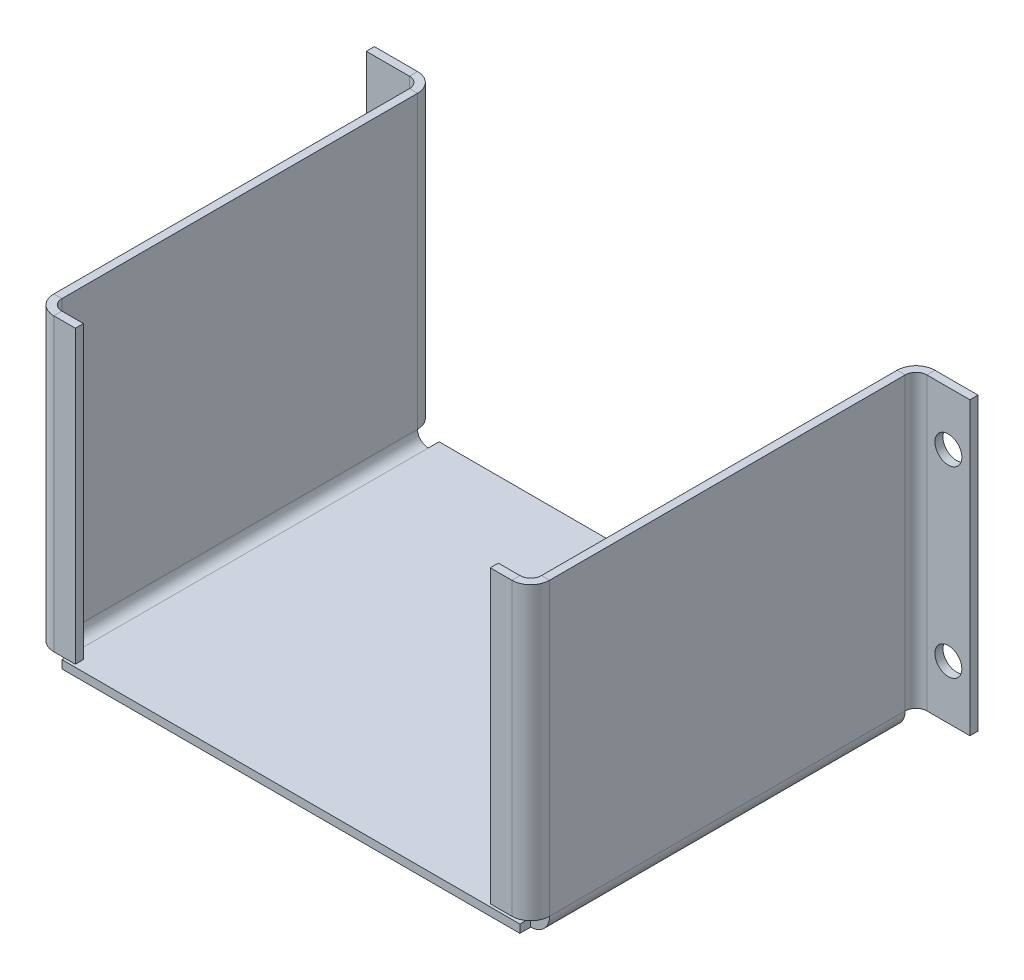
from build123d import *

# Parameters (mm, degrees)
SKETCH1_W                    = 89
SKETCH1_H                    = 70
BASE_FLANGE1_DEPTH           = 1.5
EDGE_FLANGE1_STRIP_W         = 10
EDGE_FLANGE1_STRIP_H         = 1.5
EDGE_FLANGE1_STRIP_CUT_DEPTH = 70
EDGE_FLANGE1_DEPTH           = 70
EDGE_FLANGE2_DEPTH           = 57.5
EDGE_FLANGE2_2_DEPTH         = 3.5
EDGE_FLANGE2_START           = 3.5
EDGE_FLANGE2_3_DEPTH         = 54
EDGE_FLANGE3_DEPTH           = 57.5
EDGE_FLANGE3_2_DEPTH         = 3.5
EDGE_FLANGE3_START           = 3.5
EDGE_FLANGE3_3_DEPTH         = 54
SKETCH16_R                   = 2.5
CUT_EXTRUDE1_DEPTH           = 10


# Read off the part's stored shape, not the designer's step: Edge-Flange2, Edge-Flange3
# Sheet-metal steps are written as plain solids
with BuildPart() as part:
    # Sketch1 → Base-Flange1 (new body)
    with BuildSketch(Plane(origin=(0, 0, 0), x_dir=(1, 0, 0), z_dir=(0, 1, 0))):
        Rectangle(SKETCH1_W, SKETCH1_H)
    extrude(amount=BASE_FLANGE1_DEPTH)

    # Edge-Flange1 strip (across the edge) → Edge-Flange1 strip cut (cut)
    with BuildSketch(Plane(origin=(-44.5, 1.5, -35), x_dir=(1, 0, 0), z_dir=(0, 0, 1))):
        with Locations((-3, -0.75)):
            Rectangle(EDGE_FLANGE1_STRIP_W, EDGE_FLANGE1_STRIP_H)
    edge_flange1_strip_cut = extrude(amount=EDGE_FLANGE1_STRIP_CUT_DEPTH, mode=Mode.SUBTRACT)

    # Edge-Flange1 section (across the edge) → Edge-Flange1 (add)
    with BuildSketch(Plane(origin=(-44.5, 1.5, -35), x_dir=(1, 0, 0), z_dir=(0, 0, 1))):
        with BuildLine():
            Line((-1.5, 2), (-1.5, 56))
            Line((-1.5, 56), (0, 56))
            Line((0, 56), (0, 2))
            ThreePointArc((0, 2), (0.585786438, 0.585786438), (2, 0))
            Line((2, 0), (2, -1.5))
            ThreePointArc((2, -1.5), (-0.474873734, -0.474873734), (-1.5, 2))
        make_face()
    edge_flange1 = extrude(amount=EDGE_FLANGE1_DEPTH)

    # Mirror1: Edge-Flange1 strip cut, Edge-Flange1 across plane
    add(edge_flange1_strip_cut.mirror(Plane(origin=(0, 0, 0), x_dir=(0, 0, 1), z_dir=(1, 0, 0))), mode=Mode.SUBTRACT)
    add(edge_flange1.mirror(Plane(origin=(0, 0, 0), x_dir=(0, 0, 1), z_dir=(1, 0, 0))))

    # Edge-Flange2 outline → Edge-Flange2 (cut)
    with BuildSketch(Plane(origin=(0, 0, 0), x_dir=(1, 0, 0), z_dir=(0, 1, 0))):
        with BuildLine():
            Line((45.127718677, 35), (42.5, 35))
            Line((42.5, 35), (42.5, 33))
            Line((42.5, 33), (44.5, 33))
            ThreePointArc((44.5, 33), (44.66061498, 34.048097173), (45.127718677, 35))
        make_face()
    edge_flange2 = extrude(amount=EDGE_FLANGE2_DEPTH, mode=Mode.SUBTRACT)

    # Edge-Flange2 2 outline → Edge-Flange2 2 (cut)
    with BuildSketch(Plane(origin=(0, 0, 0), x_dir=(1, 0, 0), z_dir=(0, 1, 0))):
        with BuildLine():
            ThreePointArc((45.127718677, 35), (44.66061498, 34.048097173), (44.5, 33))
            Line((44.5, 33), (46, 33))
            ThreePointArc((46, 33), (46.585786438, 34.414213562), (48, 35))
            Line((48, 35), (56, 35))
            Line((56, 35), (56, 36.5))
            Line((56, 36.5), (48, 36.5))
            ThreePointArc((48, 36.5), (46.379814826, 36.102418411), (45.127718677, 35))
        make_face()
    edge_flange2_2 = extrude(amount=EDGE_FLANGE2_2_DEPTH, mode=Mode.SUBTRACT)

    # Edge-Flange2 3 outline → Edge-Flange2 3 (add)
    with BuildSketch(Plane(origin=(0, 0, 0), x_dir=(1, 0, 0), z_dir=(0, 1, 0)).offset(EDGE_FLANGE2_START)):
        with BuildLine():
            ThreePointArc((45.127718677, 35), (44.66061498, 34.048097173), (44.5, 33))
            Line((44.5, 33), (46, 33))
            ThreePointArc((46, 33), (46.585786438, 34.414213562), (48, 35))
            Line((48, 35), (56, 35))
            Line((56, 35), (56, 36.5))
            Line((56, 36.5), (48, 36.5))
            ThreePointArc((48, 36.5), (46.379814826, 36.102418411), (45.127718677, 35))
        make_face()
    edge_flange2_3 = extrude(amount=EDGE_FLANGE2_3_DEPTH)

    # Mirror2: Edge-Flange2, Edge-Flange2 2, Edge-Flange2 3 across plane
    add(edge_flange2.mirror(Plane(origin=(0, 0, 0), x_dir=(0, 0, 1), z_dir=(1, 0, 0))), mode=Mode.SUBTRACT)
    add(edge_flange2_2.mirror(Plane(origin=(0, 0, 0), x_dir=(0, 0, 1), z_dir=(1, 0, 0))), mode=Mode.SUBTRACT)
    add(edge_flange2_3.mirror(Plane(origin=(0, 0, 0), x_dir=(0, 0, 1), z_dir=(1, 0, 0))))

    # Edge-Flange3 outline → Edge-Flange3 (cut)
    with BuildSketch(Plane(origin=(0, 0, 0), x_dir=(1, 0, 0), z_dir=(0, 1, 0))):
        with BuildLine():
            ThreePointArc((-44.5, -33), (-43.914213562, -34.414213562), (-42.5, -35))
            Line((-42.5, -35), (-42.5, -33))
            Line((-42.5, -33), (-44.5, -33))
        make_face()
        with BuildLine():
            ThreePointArc((-45.372281323, -35), (-45.83938502, -34.048097173), (-46, -33))
            Line((-46, -33), (-46, -35))
            Line((-46, -35), (-45.372281323, -35))
        make_face()
    edge_flange3 = extrude(amount=EDGE_FLANGE3_DEPTH, mode=Mode.SUBTRACT)

    # Edge-Flange3 2 outline → Edge-Flange3 2 (cut)
    with BuildSketch(Plane(origin=(0, 0, 0), x_dir=(1, 0, 0), z_dir=(0, 1, 0))):
        with BuildLine():
            ThreePointArc((-42.5, -35), (-43.914213562, -34.414213562), (-44.5, -33))
            Line((-44.5, -33), (-46, -33))
            ThreePointArc((-46, -33), (-45.83938502, -34.048097173), (-45.372281323, -35))
            Line((-45.372281323, -35), (-42.5, -35))
        make_face()
    edge_flange3_2 = extrude(amount=EDGE_FLANGE3_2_DEPTH, mode=Mode.SUBTRACT)

    # Edge-Flange3 3 outline → Edge-Flange3 3 (add)
    with BuildSketch(Plane(origin=(0, 0, 0), x_dir=(1, 0, 0), z_dir=(0, 1, 0)).offset(EDGE_FLANGE3_START)):
        with BuildLine():
            Line((-44.5, -33), (-44.5, -35))
            Line((-44.5, -35), (-45.372281323, -35))
            ThreePointArc((-45.372281323, -35), (-44.120185174, -36.102418411), (-42.5, -36.5))
            Line((-42.5, -36.5), (-38.5, -36.5))
            Line((-38.5, -36.5), (-38.5, -35))
            Line((-38.5, -35), (-42.5, -35))
            ThreePointArc((-42.5, -35), (-43.914213562, -34.414213562), (-44.5, -33))
        make_face()
    edge_flange3_3 = extrude(amount=EDGE_FLANGE3_3_DEPTH)

    # Mirror3: Edge-Flange3, Edge-Flange3 2, Edge-Flange3 3 across plane
    add(edge_flange3.mirror(Plane(origin=(0, 0, 0), x_dir=(0, 0, 1), z_dir=(1, 0, 0))), mode=Mode.SUBTRACT)
    add(edge_flange3_2.mirror(Plane(origin=(0, 0, 0), x_dir=(0, 0, 1), z_dir=(1, 0, 0))), mode=Mode.SUBTRACT)
    add(edge_flange3_3.mirror(Plane(origin=(0, 0, 0), x_dir=(0, 0, 1), z_dir=(1, 0, 0))))

    # Sketch16 → Cut-Extrude1 (cut)
    with BuildSketch(Plane.XY.offset(-35)):
        with Locations((52, 47.5)):
            Circle(SKETCH16_R)
        with Locations((52, 13.5)):
            Circle(SKETCH16_R)
        with Locations((-52, 47.5)):
            Circle(SKETCH16_R)
        with Locations((-52, 13.5)):
            Circle(SKETCH16_R)
    extrude(amount=-CUT_EXTRUDE1_DEPTH, mode=Mode.SUBTRACT)


solid = part.part
